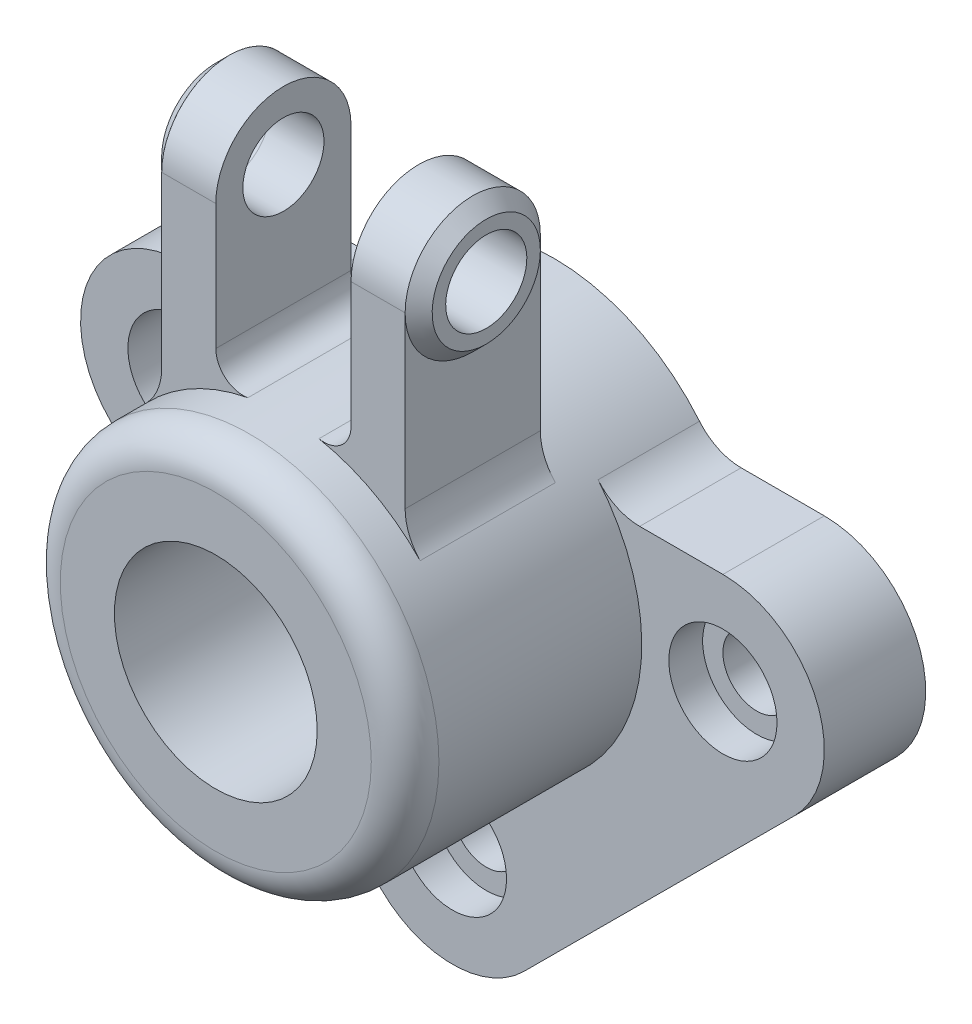
from build123d import *

# Parameters (mm, degrees)
IZIM1_R                     = 15
IZIM1_R_2                   = 5
Y_KSEKLIK_EKSTR_ZYON1_DEPTH = 15
IZIM2_R                     = 28
IZIM2_R_2                   = 15
Y_KSEKLIK_EKSTR_ZYON2_DEPTH = 35
RADYUS1_R                   = 5
IZIM3_R                     = 5
KES_EKSTR_ZYON1_DEPTH       = 15
IZIM4_R                     = 8
KES_EKSTR_ZYON2_DEPTH       = 5
Y_KSEKLIK_EKSTR_ZYON3_START = -20
Y_KSEKLIK_EKSTR_ZYON3_DEPTH = 20
IZIM6_R                     = 6
KES_EKSTR_ZYON3_DEPTH       = 8
IZIM7_R                     = 10
IZIM7_R_2                   = 6
Y_KSEKLIK_EKSTR_ZYON4_DEPTH = 2
PAH1_SIZE                   = 2
PAH1_OF_AYNALAMA1_SIZE      = 2


with BuildPart() as part:
    # Çizim1 → Yükseklik-Ekstrüzyon1 (new body)
    with BuildSketch(Plane.XY):
        with BuildLine():
            Line((-10.556856631, -50.577645382), (-50.596163509, -10.617029664))
            ThreePointArc((-50.596163509, -10.617029664), (-53.861014482, 5.733435054), (-40, 15))
            Line((-40, 15), (-27.694764848, 15))
            ThreePointArc((-27.694764848, 15), (-24.295418506, 15.758146339), (-21.54037266, 17.888888889))
            ThreePointArc((-21.54037266, 17.888888889), (0, 28), (21.54037266, 17.888888889))
            ThreePointArc((21.54037266, 17.888888889), (24.295418506, 15.758146339), (27.694764848, 15))
            Line((27.694764848, 15), (40, 15))
            ThreePointArc((40, 15), (53.861014482, 5.733435054), (50.596163509, -10.617029664))
            Line((50.596163509, -10.617029664), (10.556856631, -50.577645382))
            ThreePointArc((10.556856631, -50.577645382), (0, -54.94435692), (-10.556856631, -50.577645382))
        make_face()
        Circle(IZIM1_R, mode=Mode.SUBTRACT)
        with Locations((-40, 0)):
            Circle(IZIM1_R_2, mode=Mode.SUBTRACT)
        with Locations(Location((40, 0, 0), (0, 0, 180))):
            Circle(IZIM1_R_2, mode=Mode.SUBTRACT)
    extrude(amount=Y_KSEKLIK_EKSTR_ZYON1_DEPTH)

    # Çizim2 → Yükseklik-Ekstrüzyon2 (add)
    with BuildSketch(Plane.XY.offset(15)):
        with Locations(Location((0, 0, 0), (0, 0, 140.290983447))):
            Circle(IZIM2_R)
        Circle(IZIM2_R_2, mode=Mode.SUBTRACT)
    extrude(amount=Y_KSEKLIK_EKSTR_ZYON2_DEPTH)

    # Radyus1
    radyus1_edges = [part.edges().sort_by_distance(p)[0] for p in [
        (21.54037266, -17.888888889, 50),
    ]]
    fillet(radyus1_edges, radius=RADYUS1_R)

    # Çizim3 → Kes-Ekstrüzyon1 (cut)
    with BuildSketch(Plane.XY.offset(15)):
        with Locations((0, -40)):
            Circle(IZIM3_R)
    extrude(amount=-KES_EKSTR_ZYON1_DEPTH, mode=Mode.SUBTRACT)

    # Çizim4 → Kes-Ekstrüzyon2 (cut)
    with BuildSketch(Plane.XY.offset(15)):
        with Locations((-40, 0)):
            Circle(IZIM4_R)
        with Locations((0, -40)):
            Circle(IZIM4_R)
        with Locations((40, 0)):
            Circle(IZIM4_R)
    extrude(amount=-KES_EKSTR_ZYON2_DEPTH, mode=Mode.SUBTRACT)

    # Çizim5 → Yükseklik-Ekstrüzyon3 (add)
    with BuildSketch(Plane.XY.offset(40).offset(Y_KSEKLIK_EKSTR_ZYON3_START)):
        with BuildLine():
            Line((-18, 60), (-18, 24.899799196))
            ThreePointArc((-18, 24.899799196), (-18.576314183, 21.918375226), (-20.222222222, 19.366510486))
            ThreePointArc((-20.222222222, 19.366510486), (-13.370146039, 24.6016096), (-5.25, 27.50340888))
            ThreePointArc((-5.25, 27.50340888), (-8.549509757, 28.35026029), (-10, 31.432467291))
            Line((-10, 31.432467291), (-10, 60))
            Line((-10, 60), (-18, 60))
        make_face()
    y_kseklik_ekstr_zyon3 = extrude(amount=Y_KSEKLIK_EKSTR_ZYON3_DEPTH)

    # Çizim6 → Kes-Ekstrüzyon3 (cut)
    with BuildSketch(Plane.ZY.offset(18)):
        with BuildLine():
            Line((40, 50), (40, 60))
            Line((40, 60), (30, 60))
            ThreePointArc((30, 60), (37.071067812, 57.071067812), (40, 50))
        make_face()
        with BuildLine():
            ThreePointArc((20, 50), (22.928932188, 57.071067812), (30, 60))
            Line((30, 60), (20, 60))
            Line((20, 60), (20, 50))
        make_face()
        with Locations(Location((30, 50, 0), (0, 0, 270))):
            Circle(IZIM6_R)
    kes_ekstr_zyon3 = extrude(amount=-KES_EKSTR_ZYON3_DEPTH, mode=Mode.SUBTRACT)


with BuildPart() as body_2:
    # Çizim7 → Yükseklik-Ekstrüzyon4 (new body)
    with BuildSketch(Plane.ZY.offset(18)):
        with Locations(Location((30, 50, 0), (0, 0, 270))):
            Circle(IZIM7_R)
        with Locations(Location((30, 50, 0), (0, 0, 270))):
            Circle(IZIM7_R_2, mode=Mode.SUBTRACT)
    y_kseklik_ekstr_zyon4 = extrude(amount=Y_KSEKLIK_EKSTR_ZYON4_DEPTH)

    # Pah1
    pah1_edges = [body_2.edges().sort_by_distance(p)[0] for p in [
        (-20, 60, 30),
    ]]
    chamfer(pah1_edges, length=PAH1_SIZE - 0.0001)  # a hair under: the kernel refuses the full size


with BuildPart() as part_1:
    add(part.part)

    # Aynalama1: Yükseklik-Ekstrüzyon3, Kes-Ekstrüzyon3, Yükseklik-Ekstrüzyon4 across plane
    add(y_kseklik_ekstr_zyon3.mirror(Plane(origin=(0, 0, 0), x_dir=(0, 0, 1), z_dir=(1, 0, 0))))
    add(kes_ekstr_zyon3.mirror(Plane(origin=(0, 0, 0), x_dir=(0, 0, 1), z_dir=(1, 0, 0))), mode=Mode.SUBTRACT)
    add(y_kseklik_ekstr_zyon4.mirror(Plane(origin=(0, 0, 0), x_dir=(0, 0, 1), z_dir=(1, 0, 0))))

    # Pah1 of Aynalama1
    pah1_of_aynalama1_edges = [part_1.edges().sort_by_distance(p)[0] for p in [
        (20, 60, 30),
    ]]
    chamfer(pah1_of_aynalama1_edges, length=PAH1_OF_AYNALAMA1_SIZE - 0.0001)  # a hair under: the kernel refuses the full size


solid = Compound([body_2.part, part_1.part])
